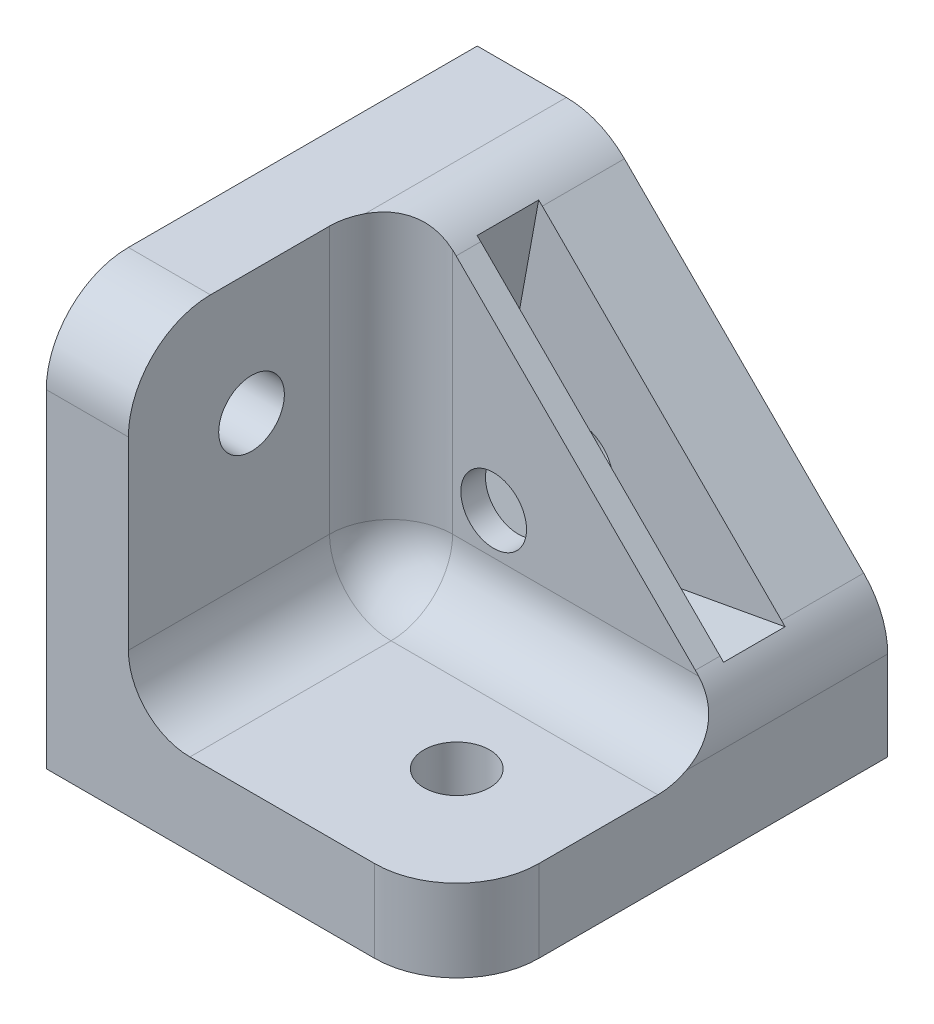
from build123d import *

# Parameters (mm, degrees)
BOSS_EXTRUDE4_DEPTH                  = 8.2
BOSS_EXTRUDE5_DEPTH                  = 21
F_3_2_3_2_DIAMETER_HOLE1_D           = 3.2
F_3_2_3_2_DIAMETER_HOLE1_ON_FACE_2_D = 3.2
F_3_2_3_2_DIAMETER_HOLE1_ON_FACE_3_D = 3.2
FILLET1_R                            = 3
FILLET2_R                            = 4
CUT_EXTRUDE2_START                   = -4
CUT_EXTRUDE2_DEPTH                   = 3


with BuildPart() as part:
    # Sketch4 → Boss-Extrude4 (new body)
    with BuildSketch(Plane.XY):
        Polygon((0, 20), (0, 0), (20, 0), (20, 6), (6, 20), align=None)
    extrude(amount=BOSS_EXTRUDE4_DEPTH)

    # Sketch4<4> → Boss-Extrude5 (add)
    with BuildSketch(Plane.XY):
        Polygon((0, 20), (0, 0), (20, 0), (20, 4), (4, 4), (4, 20), align=None)
    extrude(amount=BOSS_EXTRUDE5_DEPTH)

    # Ø3.2 (3.2) Diameter Hole1 (through all)
    with Locations(Plane(origin=(14, 0, 15), x_dir=(0, 0, -1), z_dir=(0, -1, 0))):
        with Locations((0, 0)):
            Hole(F_3_2_3_2_DIAMETER_HOLE1_D / 2)

    # Ø3.2 (3.2) Diameter Hole1 on face 2 (through all)
    with Locations(Plane(origin=(0, 14, 15), x_dir=(0, 0, -1), z_dir=(-1, 0, 0))):
        with Locations((0, 0)):
            Hole(F_3_2_3_2_DIAMETER_HOLE1_ON_FACE_2_D / 2)

    # Ø3.2 (3.2) Diameter Hole1 on face 3 (through all)
    with Locations(Plane(origin=(9, 9, 0), x_dir=(-1, 0, 0), z_dir=(0, 0, -1))):
        with Locations((0, 0)):
            Hole(F_3_2_3_2_DIAMETER_HOLE1_ON_FACE_3_D / 2)

    # Fillet1
    fillet1_edges = [part.edges().sort_by_distance(p)[0] for p in [
        (12, 4, 8.2),
        (4, 4, 14.6),
        (4, 12, 8.2),
    ]]
    fillet(fillet1_edges, radius=FILLET1_R)

    # Fillet2
    fillet2_edges = [part.edges().sort_by_distance(p)[0] for p in [
        (6, 20, 4.185786438),
        (20, 6, 4.185786438),
        (20, 2, 21),
        (2, 20, 21),
    ]]
    fillet(fillet2_edges, radius=FILLET2_R)

    # Sketch7 → Cut-Extrude2 (cut)
    with BuildSketch(Plane(origin=(0, 0, 0), x_dir=(-1, 0, 0), z_dir=(0, 0, -1)).offset(CUT_EXTRUDE2_START)):
        Polygon((-6.993236121, 19.006763879), (-4.968154398, 7.912787482), (-7.912787482, 4.968154398), (-19.006763879, 6.993236121), align=None)
    extrude(amount=-CUT_EXTRUDE2_DEPTH, mode=Mode.SUBTRACT)


solid = part.part
